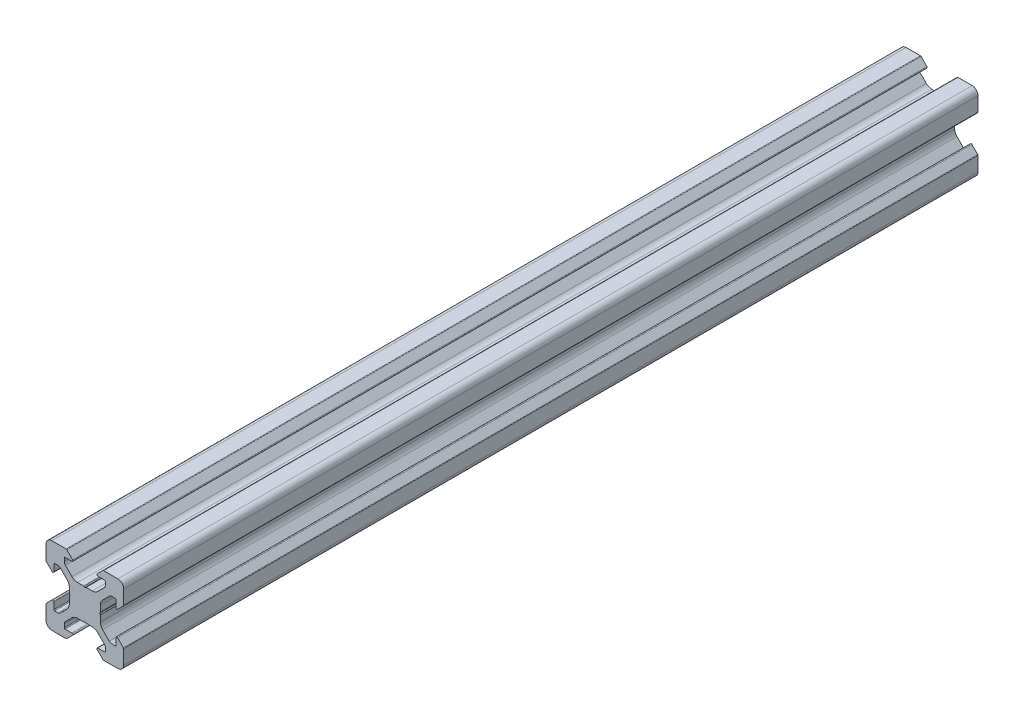
from build123d import *

# Parameters (mm, degrees)
EXTRUDE_1_DEPTH = 220


# Read off the part's stored shape, not the designer's step: 222 Конструкционный профиль 20х20-1-surface1
with BuildPart() as part:
    # Эскиз1 → Бобышка-Вытянуть1 (new body)
    with BuildSketch(Plane.XY):
        with BuildLine():
            Line((-3.945217202, 0.181521503), (-3.8, 0))
            Line((-3.8, 0), (-3.945217202, -0.181521503))
            ThreePointArc((-3.945217202, -0.181521503), (-3.98590708, -0.254943529), (-4, -0.337695265))
            Line((-4, -0.337695265), (-4, -1.898780669))
            ThreePointArc((-4, -1.898780669), (-4.152240935, -2.664147534), (-4.585786438, -3.312994231))
            Line((-4.585786438, -3.312994231), (-6.279898987, -5.007106781))
            ThreePointArc((-6.279898987, -5.007106781), (-6.604322336, -5.223879533), (-6.987005769, -5.3))
            Line((-6.987005769, -5.3), (-7.8, -5.3))
            ThreePointArc((-7.8, -5.3), (-7.941421356, -5.241421356), (-8, -5.1))
            Line((-8, -5.1), (-8, -3.33))
            ThreePointArc((-8, -3.33), (-8.154329142, -3.099030117), (-8.426776695, -3.153223305))
            Line((-8.426776695, -3.153223305), (-9.926776695, -4.653223305))
            ThreePointArc((-9.926776695, -4.653223305), (-9.980969883, -4.734329142), (-10, -4.83))
            Line((-10, -4.83), (-10, -8.5))
            ThreePointArc((-10, -8.5), (-9.560660172, -9.560660172), (-8.5, -10))
            Line((-8.5, -10), (-4.83, -10))
            ThreePointArc((-4.83, -10), (-4.734329142, -9.980969883), (-4.653223305, -9.926776695))
            Line((-4.653223305, -9.926776695), (-3.153223305, -8.426776695))
            ThreePointArc((-3.153223305, -8.426776695), (-3.099030117, -8.154329142), (-3.33, -8))
            Line((-3.33, -8), (-5.1, -8))
            ThreePointArc((-5.1, -8), (-5.241421356, -7.941421356), (-5.3, -7.8))
            Line((-5.3, -7.8), (-5.3, -6.987005769))
            ThreePointArc((-5.3, -6.987005769), (-5.223879533, -6.604322336), (-5.007106781, -6.279898987))
            Line((-5.007106781, -6.279898987), (-3.312994231, -4.585786438))
            ThreePointArc((-3.312994231, -4.585786438), (-2.664147534, -4.152240935), (-1.898780669, -4))
            Line((-1.898780669, -4), (-0.337695265, -4))
            ThreePointArc((-0.337695265, -4), (-0.254943529, -3.98590708), (-0.181521503, -3.945217202))
            Line((-0.181521503, -3.945217202), (0, -3.8))
            Line((0, -3.8), (0.181521503, -3.945217202))
            ThreePointArc((0.181521503, -3.945217202), (0.254943529, -3.98590708), (0.337695265, -4))
            Line((0.337695265, -4), (1.898780669, -4))
            ThreePointArc((1.898780669, -4), (2.664147534, -4.152240935), (3.312994231, -4.585786438))
            Line((3.312994231, -4.585786438), (5.007106781, -6.279898987))
            ThreePointArc((5.007106781, -6.279898987), (5.223879533, -6.604322336), (5.3, -6.987005769))
            Line((5.3, -6.987005769), (5.3, -7.8))
            ThreePointArc((5.3, -7.8), (5.241421356, -7.941421356), (5.1, -8))
            Line((5.1, -8), (3.33, -8))
            ThreePointArc((3.33, -8), (3.099030117, -8.154329142), (3.153223305, -8.426776695))
            Line((3.153223305, -8.426776695), (4.653223305, -9.926776695))
            ThreePointArc((4.653223305, -9.926776695), (4.734329142, -9.980969883), (4.83, -10))
            Line((4.83, -10), (8.5, -10))
            ThreePointArc((8.5, -10), (9.560660172, -9.560660172), (10, -8.5))
            Line((10, -8.5), (10, -4.83))
            ThreePointArc((10, -4.83), (9.980969883, -4.734329142), (9.926776695, -4.653223305))
            Line((9.926776695, -4.653223305), (8.426776695, -3.153223305))
            ThreePointArc((8.426776695, -3.153223305), (8.154329142, -3.099030117), (8, -3.33))
            Line((8, -3.33), (8, -5.1))
            ThreePointArc((8, -5.1), (7.941421356, -5.241421356), (7.8, -5.3))
            Line((7.8, -5.3), (6.987005769, -5.3))
            ThreePointArc((6.987005769, -5.3), (6.604322336, -5.223879533), (6.279898987, -5.007106781))
            Line((6.279898987, -5.007106781), (4.585786438, -3.312994231))
            ThreePointArc((4.585786438, -3.312994231), (4.152240935, -2.664147534), (4, -1.898780669))
            Line((4, -1.898780669), (4, -0.337695265))
            ThreePointArc((4, -0.337695265), (3.98590708, -0.254943529), (3.945217202, -0.181521503))
            Line((3.945217202, -0.181521503), (3.8, 0))
            Line((3.8, 0), (3.945217202, 0.181521503))
            ThreePointArc((3.945217202, 0.181521503), (3.98590708, 0.254943529), (4, 0.337695265))
            Line((4, 0.337695265), (4, 1.898780669))
            ThreePointArc((4, 1.898780669), (4.152240935, 2.664147534), (4.585786438, 3.312994231))
            Line((4.585786438, 3.312994231), (6.279898987, 5.007106781))
            ThreePointArc((6.279898987, 5.007106781), (6.604322336, 5.223879533), (6.987005769, 5.3))
            Line((6.987005769, 5.3), (7.8, 5.3))
            ThreePointArc((7.8, 5.3), (7.941421356, 5.241421356), (8, 5.1))
            Line((8, 5.1), (8, 3.33))
            ThreePointArc((8, 3.33), (8.154329142, 3.099030117), (8.426776695, 3.153223305))
            Line((8.426776695, 3.153223305), (9.926776695, 4.653223305))
            ThreePointArc((9.926776695, 4.653223305), (9.980969883, 4.734329142), (10, 4.83))
            Line((10, 4.83), (10, 8.5))
            ThreePointArc((10, 8.5), (9.560660172, 9.560660172), (8.5, 10))
            Line((8.5, 10), (4.83, 10))
            ThreePointArc((4.83, 10), (4.734329142, 9.980969883), (4.653223305, 9.926776695))
            Line((4.653223305, 9.926776695), (3.153223305, 8.426776695))
            ThreePointArc((3.153223305, 8.426776695), (3.099030117, 8.154329142), (3.33, 8))
            Line((3.33, 8), (5.1, 8))
            ThreePointArc((5.1, 8), (5.241421356, 7.941421356), (5.3, 7.8))
            Line((5.3, 7.8), (5.3, 6.987005769))
            ThreePointArc((5.3, 6.987005769), (5.223879533, 6.604322336), (5.007106781, 6.279898987))
            Line((5.007106781, 6.279898987), (3.312994231, 4.585786438))
            ThreePointArc((3.312994231, 4.585786438), (2.664147534, 4.152240935), (1.898780669, 4))
            Line((1.898780669, 4), (0.337695265, 4))
            ThreePointArc((0.337695265, 4), (0.254943529, 3.98590708), (0.181521503, 3.945217202))
            Line((0.181521503, 3.945217202), (0, 3.8))
            Line((0, 3.8), (-0.181521503, 3.945217202))
            ThreePointArc((-0.181521503, 3.945217202), (-0.254943529, 3.98590708), (-0.337695265, 4))
            Line((-0.337695265, 4), (-1.898780669, 4))
            ThreePointArc((-1.898780669, 4), (-2.664147534, 4.152240935), (-3.312994231, 4.585786438))
            Line((-3.312994231, 4.585786438), (-5.007106781, 6.279898987))
            ThreePointArc((-5.007106781, 6.279898987), (-5.223879533, 6.604322336), (-5.3, 6.987005769))
            Line((-5.3, 6.987005769), (-5.3, 7.8))
            ThreePointArc((-5.3, 7.8), (-5.241421356, 7.941421356), (-5.1, 8))
            Line((-5.1, 8), (-3.33, 8))
            ThreePointArc((-3.33, 8), (-3.099030117, 8.154329142), (-3.153223305, 8.426776695))
            Line((-3.153223305, 8.426776695), (-4.653223305, 9.926776695))
            ThreePointArc((-4.653223305, 9.926776695), (-4.734329142, 9.980969883), (-4.83, 10))
            Line((-4.83, 10), (-8.5, 10))
            ThreePointArc((-8.5, 10), (-9.560660172, 9.560660172), (-10, 8.5))
            Line((-10, 8.5), (-10, 4.83))
            ThreePointArc((-10, 4.83), (-9.980969883, 4.734329142), (-9.926776695, 4.653223305))
            Line((-9.926776695, 4.653223305), (-8.426776695, 3.153223305))
            ThreePointArc((-8.426776695, 3.153223305), (-8.154329142, 3.099030117), (-8, 3.33))
            Line((-8, 3.33), (-8, 5.1))
            ThreePointArc((-8, 5.1), (-7.941421356, 5.241421356), (-7.8, 5.3))
            Line((-7.8, 5.3), (-6.987005769, 5.3))
            ThreePointArc((-6.987005769, 5.3), (-6.604322336, 5.223879533), (-6.279898987, 5.007106781))
            Line((-6.279898987, 5.007106781), (-4.585786438, 3.312994231))
            ThreePointArc((-4.585786438, 3.312994231), (-4.152240935, 2.664147534), (-4, 1.898780669))
            Line((-4, 1.898780669), (-4, 0.337695265))
            ThreePointArc((-4, 0.337695265), (-3.98590708, 0.254943529), (-3.945217202, 0.181521503))
        make_face()
    extrude(amount=EXTRUDE_1_DEPTH)


solid = part.part
